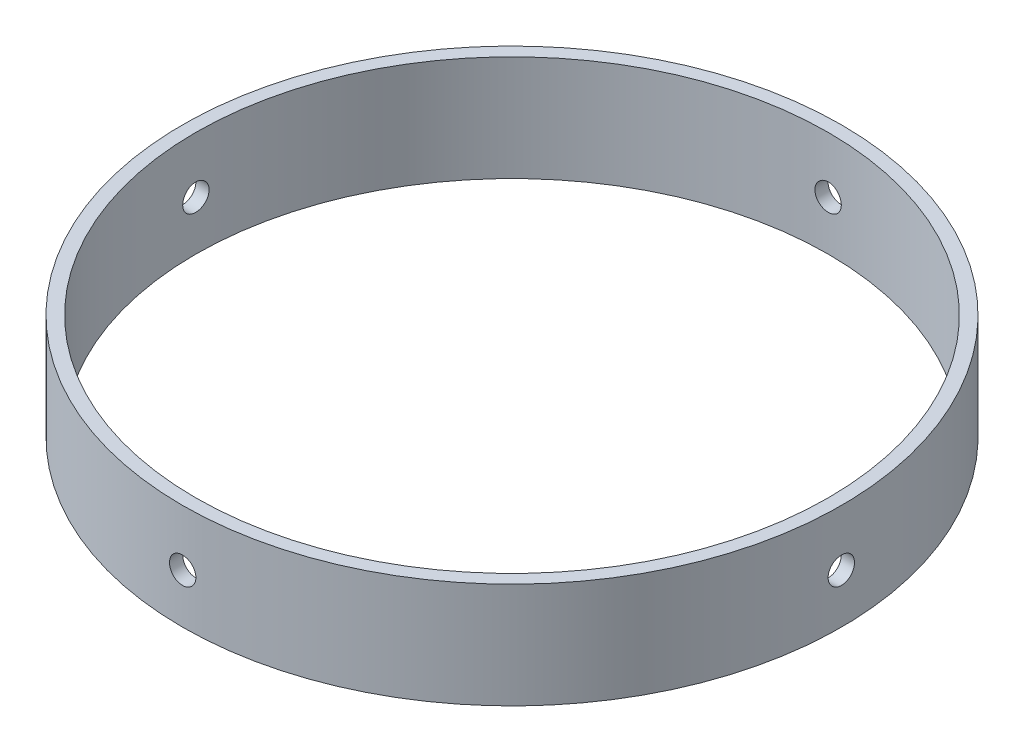
from build123d import *

# Parameters (mm, degrees)
SKETCH1_R           = 79.375
SKETCH1_R_2         = 76.2
BOSS_EXTRUDE1_DEPTH = 25.4
CUT_EXTRUDE4_REACH  = 181.296
SKETCH2_R           = 3.175
CIRPATTERN1_COUNT   = 4


with BuildPart() as part:
    # Sketch1 → Boss-Extrude1 (new body)
    with BuildSketch(Plane(origin=(0, 0, 0), x_dir=(1, 0, 0), z_dir=(0, 1, 0))):
        Circle(SKETCH1_R)
        Circle(SKETCH1_R_2, mode=Mode.SUBTRACT)
    extrude(amount=BOSS_EXTRUDE1_DEPTH)

    # Sketch2 → Cut-Extrude4 (cut, up to next)
    with BuildSketch(Plane.XY.offset(79.375), mode=Mode.PRIVATE) as cut_extrude4_sk1:
        with Locations((0, 11.890925676)):
            Circle(SKETCH2_R)
    cut_extrude4_tool1 = extrude(cut_extrude4_sk1.sketch, amount=-CUT_EXTRUDE4_REACH, mode=Mode.PRIVATE) & part.part
    cut_extrude4 = cut_extrude4_tool1.solids().sort_by_distance((0, 11.890926, 79.375))[0]
    add(cut_extrude4, mode=Mode.SUBTRACT)

    # CirPattern1: Cut-Extrude4 ×4 about axis
    cirpattern1_axis = Axis((0, 25.4, 0), (0, -1, 0))
    for i in range(1, CIRPATTERN1_COUNT):
        add(cut_extrude4.rotate(cirpattern1_axis, i * 360 / CIRPATTERN1_COUNT), mode=Mode.SUBTRACT)


solid = part.part
